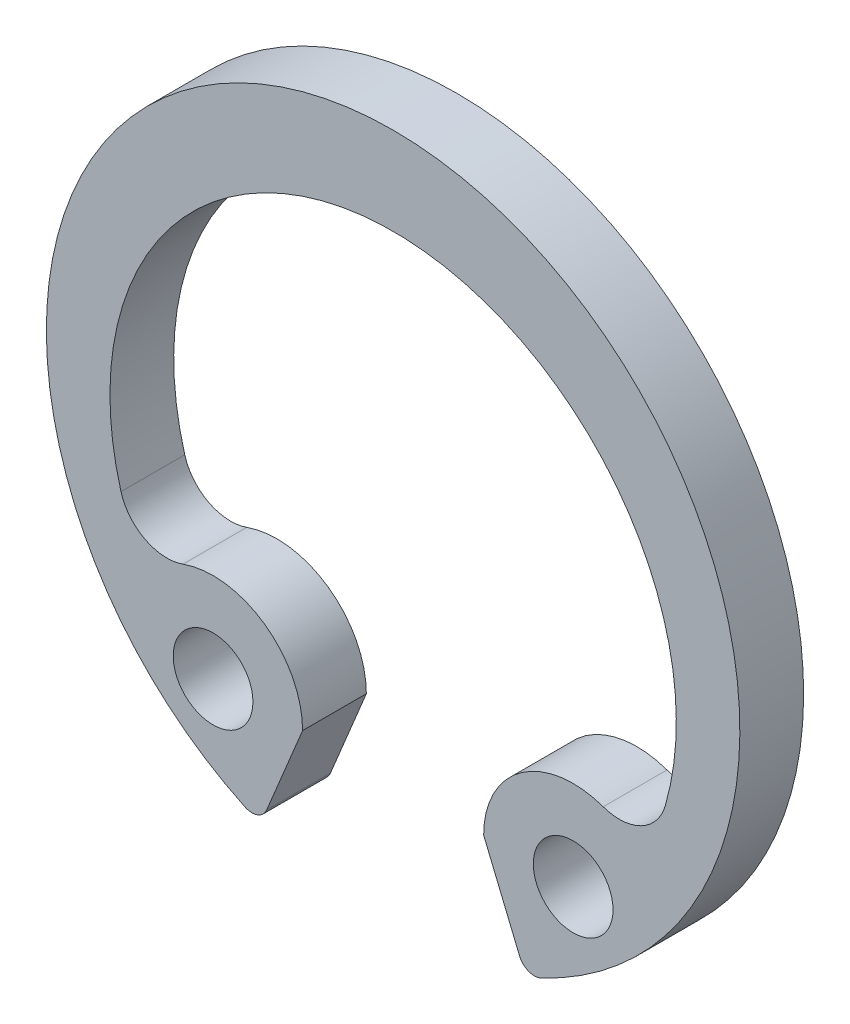
from build123d import *

# Parameters (mm, degrees)
BODYSKE_R      = 0.5
BASEBODY_DEPTH = 0.8
FILLET1_R      = 0.6
FILLET2_R      = 0.2


with BuildPart() as part:
    # BodySke → BaseBody (new body)
    with BuildSketch(Plane.XY):
        with BuildLine():
            ThreePointArc((2.688558404, -1.704362755), (1.634856357, -1.808143348), (1.135741275, -2.741921989))
            Line((1.135741275, -2.741921989), (1.664672931, -4.018875966))
            ThreePointArc((1.664672931, -4.018875966), (0, 4.35), (-1.664672931, -4.018875966))
            Line((-1.664672931, -4.018875966), (-1.135741275, -2.741921989))
            ThreePointArc((-1.135741275, -2.741921989), (-1.634856357, -1.808143348), (-2.688558404, -1.704362755))
            Line((-2.688558404, -1.704362755), (-3.170945654, -1.904174096))
            ThreePointArc((-3.170945654, -1.904174096), (0, 3.25), (3.170945654, -1.904174096))
            Line((3.170945654, -1.904174096), (2.688558404, -1.704362755))
        make_face()
        with Locations((-2.258787298, -2.741921989)):
            Circle(BODYSKE_R, mode=Mode.SUBTRACT)
        with Locations((2.258787298, -2.741921989)):
            Circle(BODYSKE_R, mode=Mode.SUBTRACT)
    extrude(amount=BASEBODY_DEPTH)

    # Fillet1
    fillet1_edges = [part.edges().sort_by_distance(p)[0] for p in [
        (3.170945654, -1.904174096, 0.4),
        (-3.170945654, -1.904174096, 0.4),
    ]]
    fillet(fillet1_edges, radius=FILLET1_R)

    # Fillet2
    fillet2_edges = [part.edges().sort_by_distance(p)[0] for p in [
        (1.664672931, -4.018875966, 0.4),
        (-1.664672931, -4.018875966, 0.4),
    ]]
    fillet(fillet2_edges, radius=FILLET2_R)


solid = part.part
